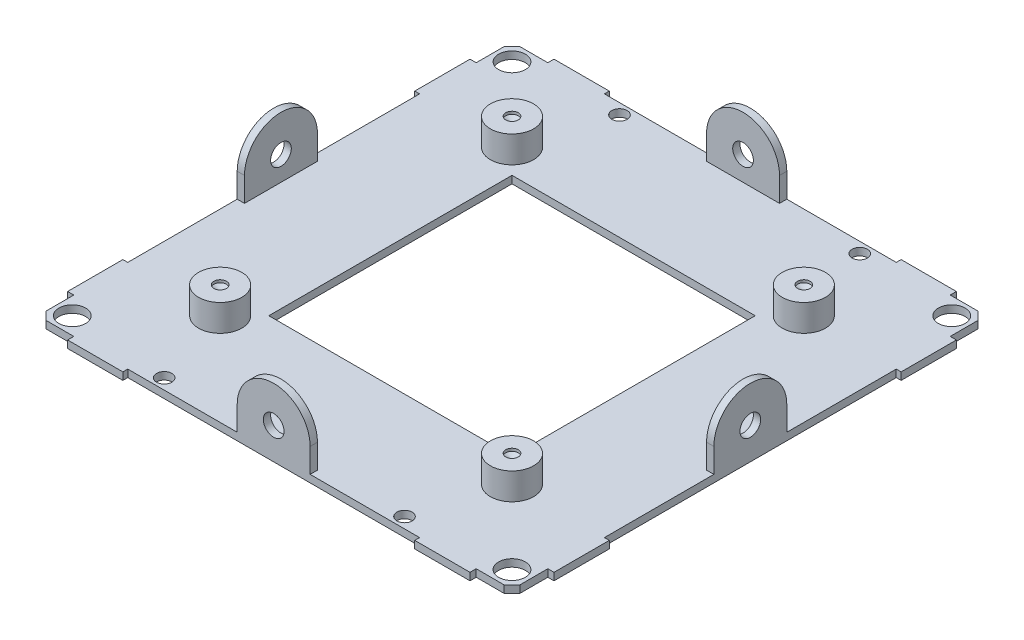
from build123d import *

# Parameters (mm, degrees)
SKETCH1_R                 = 2.7503
SKETCH1_R_2               = 1.575
SKETCH1_W                 = 50
SKETCH1_H                 = 50
BOSS_EXTRUDE1_DEPTH       = 1.524
SKETCH2_W                 = 15
SKETCH2_H                 = 2.5
SKETCH2_W_2               = 2.5
SKETCH2_H_2               = 15
BOSS_EXTRUDE2_DEPTH       = 12.476
CUT_EXTRUDE1_DEPTH        = 113.676528168
CUT_EXTRUDE1_DEPTH_BACK   = 113.676528168
SKETCH3_R                 = 2.125
CUT_EXTRUDE2_DEPTH        = 113.676528168
CUT_EXTRUDE2_DEPTH_BACK   = 113.676528168
SKETCH4_R                 = 2.125
CUT_EXTRUDE3_DEPTH        = 73.083285164
CUT_EXTRUDE3_DEPTH_BACK   = 73.083285164
SKETCH5_W                 = 60
SKETCH5_H                 = 1
SKETCH5_W_2               = 1
SKETCH5_H_2               = 60
SKETCH6_R                 = 4.445
BOSS_EXTRUDE3_DEPTH       = 5.5
F_5_40_TAPPED_HOLE1_D     = 2.5781
F_5_40_TAPPED_HOLE1_DEPTH = 0.55
F_5_40_TAPPED_HOLE1_TIP   = 0.774539381


with BuildPart() as part:
    # Sketch1 → Boss-Extrude1 (new body)
    with BuildSketch(Plane(origin=(0, 0, 0), x_dir=(1, 0, 0), z_dir=(0, 1, 0))):
        Polygon((41.364, 50), (-41.364, 50), (-41.364, 48.73), (-47.079, 48.73), (-48.73, 47.079), (-48.73, 41.364), (-50, 41.364), (-50, -41.364), (-48.73, -41.364), (-48.73, -47.079), (-47.079, -48.73), (-41.364, -48.73), (-41.364, -50), (41.364, -50), (41.364, -48.73), (47.079, -48.73), (48.73, -47.079), (48.73, -41.364), (50, -41.364), (50, 41.364), (48.73, 41.364), (48.73, 47.079), (47.079, 48.73), (41.364, 48.73), align=None)
        with Locations((-45.2, -45.2)):
            Circle(SKETCH1_R, mode=Mode.SUBTRACT)
        with Locations((-24.7, -46.8)):
            Circle(SKETCH1_R_2, mode=Mode.SUBTRACT)
        with Locations((24.7, -46.8)):
            Circle(SKETCH1_R_2, mode=Mode.SUBTRACT)
        with Locations((45.2, -45.2)):
            Circle(SKETCH1_R, mode=Mode.SUBTRACT)
        Rectangle(SKETCH1_W, SKETCH1_H, mode=Mode.SUBTRACT)
        with Locations((-45.2, 45.2)):
            Circle(SKETCH1_R, mode=Mode.SUBTRACT)
        with Locations((-24.7, 46.8)):
            Circle(SKETCH1_R_2, mode=Mode.SUBTRACT)
        with BuildLine():
            ThreePointArc((26.275, 46.8), (24.7, 45.225), (23.125, 46.8))
            ThreePointArc((23.125, 46.8), (24.7, 48.375), (26.275, 46.8))
        make_face(mode=Mode.SUBTRACT)
        with Locations((45.2, 45.2)):
            Circle(SKETCH1_R, mode=Mode.SUBTRACT)
    extrude(amount=BOSS_EXTRUDE1_DEPTH)

    # Sketch2 → Boss-Extrude2 (add)
    with BuildSketch(Plane(origin=(0, 1.524, 0), x_dir=(1, 0, 0), z_dir=(0, 1, 0))):
        with Locations((0, 48.75)):
            Rectangle(SKETCH2_W, SKETCH2_H)
        with Locations((48.75, 0)):
            Rectangle(SKETCH2_W_2, SKETCH2_H_2)
        with Locations((0, -48.75)):
            Rectangle(SKETCH2_W, SKETCH2_H)
        with Locations((-48.75, 0)):
            Rectangle(SKETCH2_W_2, SKETCH2_H_2)
    extrude(amount=BOSS_EXTRUDE2_DEPTH)

    # Sketch3 → Cut-Extrude1 (cut, two sides: drawn at the far end of the back side and taken through both)
    with BuildSketch(Plane.XY.offset(50).offset(-CUT_EXTRUDE1_DEPTH_BACK)):
        with BuildLine():
            ThreePointArc((0, 14), (5.303300859, 11.803300859), (7.5, 6.5))
            Line((7.5, 6.5), (7.5, 14))
            Line((7.5, 14), (0, 14))
        make_face()
        with BuildLine():
            ThreePointArc((-7.5, 6.5), (-5.303300859, 11.803300859), (0, 14))
            Line((0, 14), (-7.5, 14))
            Line((-7.5, 14), (-7.5, 6.5))
        make_face()
        with Locations((0, 6.5)):
            Circle(SKETCH3_R)
    extrude(amount=CUT_EXTRUDE1_DEPTH + CUT_EXTRUDE1_DEPTH_BACK, mode=Mode.SUBTRACT)

    # Sketch4 → Cut-Extrude2 (cut, two sides: drawn at the far end of the back side and taken through both)
    with BuildSketch(Plane.ZY.offset(50).offset(-CUT_EXTRUDE2_DEPTH_BACK)):
        with BuildLine():
            ThreePointArc((0, 14), (5.303300859, 11.803300859), (7.5, 6.5))
            Line((7.5, 6.5), (7.5, 14))
            Line((7.5, 14), (0, 14))
        make_face()
        with BuildLine():
            ThreePointArc((-7.5, 6.5), (-5.303300859, 11.803300859), (0, 14))
            Line((0, 14), (-7.5, 14))
            Line((-7.5, 14), (-7.5, 6.5))
        make_face()
        with Locations((0, 6.5)):
            Circle(SKETCH4_R)
    extrude(amount=CUT_EXTRUDE2_DEPTH + CUT_EXTRUDE2_DEPTH_BACK, mode=Mode.SUBTRACT)

    # Sketch5 → Cut-Extrude3 (cut, two sides: drawn at the far end of the back side and taken through both)
    with BuildSketch(Plane.XZ.offset(-CUT_EXTRUDE3_DEPTH_BACK)):
        with Locations((0, -49.5)):
            Rectangle(SKETCH5_W, SKETCH5_H)
        with Locations((-49.5, 0)):
            Rectangle(SKETCH5_W_2, SKETCH5_H_2)
        with Locations((0, 49.5)):
            Rectangle(SKETCH5_W, SKETCH5_H)
        with Locations((49.5, 0)):
            Rectangle(SKETCH5_W_2, SKETCH5_H_2)
    extrude(amount=CUT_EXTRUDE3_DEPTH + CUT_EXTRUDE3_DEPTH_BACK, mode=Mode.SUBTRACT)

    # Sketch6 → Boss-Extrude3 (add)
    with BuildSketch(Plane(origin=(0, 1.524, 0), x_dir=(1, 0, 0), z_dir=(0, 1, 0))):
        with Locations((30, 30)):
            Circle(SKETCH6_R)
        with Locations((30, -30)):
            Circle(SKETCH6_R)
        with Locations((-30, -30)):
            Circle(SKETCH6_R)
        with Locations((-30, 30)):
            Circle(SKETCH6_R)
    extrude(amount=BOSS_EXTRUDE3_DEPTH)

    # #5-40 Tapped Hole1
    with Locations(Plane(origin=(0, 7.024, 0), x_dir=(1, 0, 0), z_dir=(0, 1, 0))):
        with Locations((-17.222965343, 16.834933913), (-30, 30), (-30, -30), (30, -30), (30, 30)):
            Hole(F_5_40_TAPPED_HOLE1_D / 2, depth=F_5_40_TAPPED_HOLE1_DEPTH)
            with Locations((0, 0, -(F_5_40_TAPPED_HOLE1_DEPTH + F_5_40_TAPPED_HOLE1_TIP / 2))):  # 118° drill point
                Cone(0, F_5_40_TAPPED_HOLE1_D / 2, F_5_40_TAPPED_HOLE1_TIP, mode=Mode.SUBTRACT)


solid = part.part
